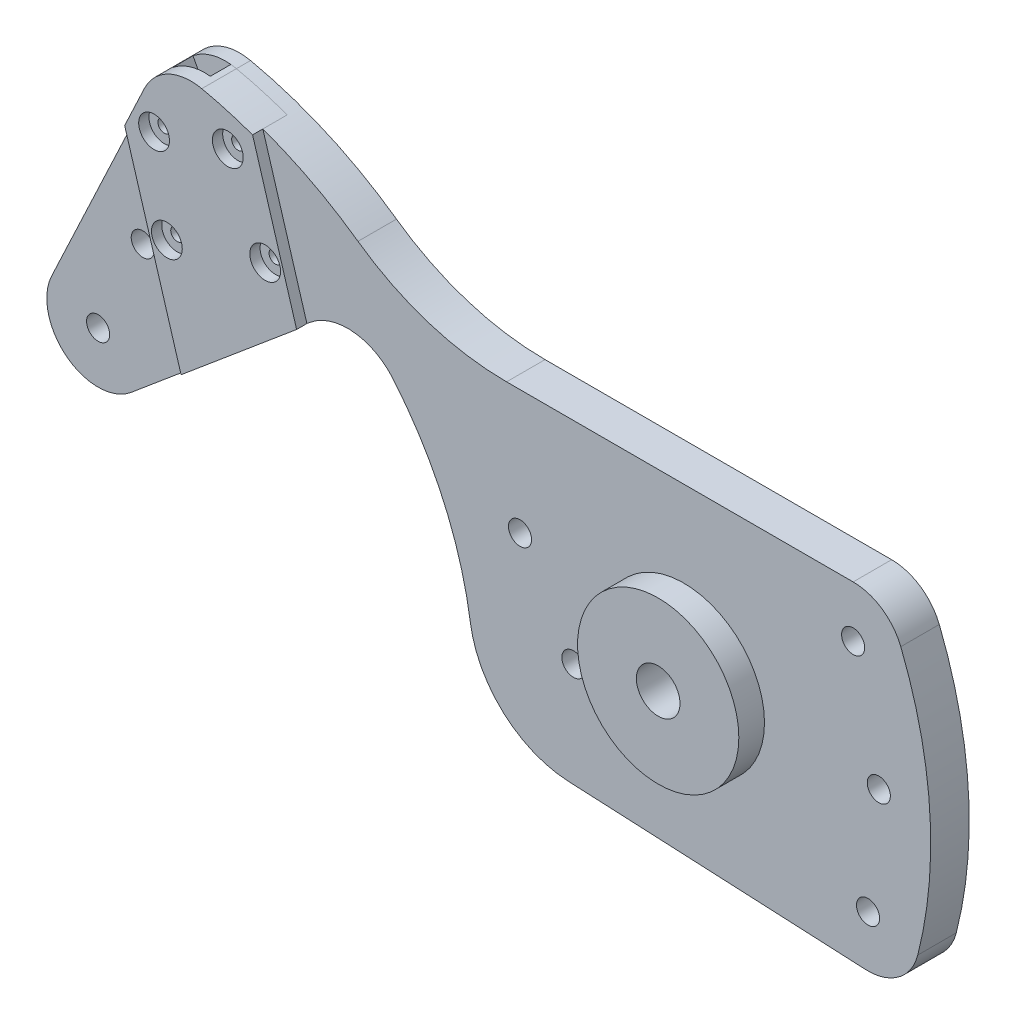
from build123d import *

# Parameters (mm, degrees)
SKETCH1_R              = 2.25
SKETCH1_R_2            = 4.25
BOSS_EXTRUDE1_DEPTH    = 4.75
CUT_EXTRUDE1_DEPTH     = 2
SKETCH4_R              = 1.25
CUT_EXTRUDE2_DEPTH     = 136.849086626
SKETCH5_R              = 3
CUT_EXTRUDE3_DEPTH     = 2
SPLIT3_SURFACE_1_BACK  = 193.818
SPLIT3_SURFACE_1_DEPTH = 387.636
SPLIT3_SURFACE_2_BACK  = 193.818
SPLIT3_SURFACE_2_DEPTH = 387.636
SKETCH6_R              = 15.710018396
CUT_EXTRUDE4_DEPTH     = 2
SKETCH7_R              = 15.710018396
SKETCH7_R_2            = 4.25
BOSS_EXTRUDE2_DEPTH    = 3


with BuildPart() as part:
    # Sketch1 → Boss-Extrude1 (new, symmetric)
    with BuildSketch(Plane.XY):
        with BuildLine():
            Line((-22.500230832, -28.983987123), (35.398437983, -31.788291003))
            ThreePointArc((35.398437983, -31.788291003), (41.825152283, -29.842482755), (45.572267137, -24.270413418))
            ThreePointArc((45.572267137, -24.270413418), (47.922199842, 1.185089324), (42.266415188, 26.115330067))
            ThreePointArc((42.266415188, 26.115330067), (38.587871094, 30.681102), (32.982217728, 32.4))
            Line((32.982217728, 32.4), (-34.53815208, 32.4))
            ThreePointArc((-34.53815208, 32.4), (-49.730929753, 34.764094355), (-63.487021029, 41.632819737))
            ThreePointArc((-63.487021029, 41.632819737), (-77.067258547, 49.344582351), (-91.918742124, 54.174444589))
            ThreePointArc((-91.918742124, 54.174444589), (-98.466295495, 53.366674665), (-103.085929893, 48.656905518))
            Line((-103.085929893, 48.656905518), (-123.167077545, 5.955614534))
            ThreePointArc((-123.167077545, 5.955614534), (-120.218280198, -6.2236308), (-107.689906175, -5.960444431))
            Line((-107.689906175, -5.960444431), (-72.864818345, 23.261273923))
            ThreePointArc((-72.864818345, 23.261273923), (-64.470178387, 25.908093735), (-56.662687309, 21.843771132))
            ThreePointArc((-56.662687309, 21.843771132), (-46.809939593, 6.135423294), (-41.608278072, -11.662653759))
            ThreePointArc((-41.608278072, -11.662653759), (-35.156858245, -23.745961099), (-22.500230832, -28.983987123))
        make_face()
        with Locations((35.882217728, -21.8)):
            Circle(SKETCH1_R, mode=Mode.SUBTRACT)
        with Locations((-21.517782272, -8.7)):
            Circle(SKETCH1_R, mode=Mode.SUBTRACT)
        Circle(SKETCH1_R_2, mode=Mode.SUBTRACT)
        with Locations((-31.917782272, 8.2)):
            Circle(SKETCH1_R, mode=Mode.SUBTRACT)
        with Locations((37.982217728, -0.1)):
            Circle(SKETCH1_R, mode=Mode.SUBTRACT)
        with Locations((32.982217728, 22.4)):
            Circle(SKETCH1_R, mode=Mode.SUBTRACT)
        with Locations((-105.417782272, 20.2)):
            Circle(SKETCH1_R, mode=Mode.SUBTRACT)
        with Locations((-114.117782272, 1.7)):
            Circle(SKETCH1_R, mode=Mode.SUBTRACT)
    extrude(amount=BOSS_EXTRUDE1_DEPTH, both=True)

    # Sketch2 → Cut-Extrude1 (cut, symmetric)
    with BuildSketch(Plane.XY):
        with BuildLine():
            Line((-78.227129447, 18.761760655), (-92.084556702, 44.987885053))
            Line((-92.084556702, 44.987885053), (-93.002217677, 54.347646176))
            ThreePointArc((-93.002217677, 54.347646176), (-96.914482214, 53.978242129), (-100.382341665, 52.129939126))
            Line((-100.382341665, 52.129939126), (-95.988712538, 43.814696916))
            Line((-95.988712538, 43.814696916), (-92.369017313, 6.895307763))
            Line((-92.369017313, 6.895307763), (-78.227129447, 18.761760655))
        make_face()
    extrude(amount=CUT_EXTRUDE1_DEPTH, both=True, mode=Mode.SUBTRACT)

    # Sketch4 → Cut-Extrude2 (cut, through all)
    with BuildSketch(Plane.XY.offset(4.75)):
        with Locations((-98.721244854, 25.242626445)):
            Circle(SKETCH4_R)
        with Locations((-101.219347979, 42.242905289)):
            Circle(SKETCH4_R)
        with Locations((-86.853921262, 46.55967668)):
            Circle(SKETCH4_R)
        with Locations((-79.567342565, 30.998321633)):
            Circle(SKETCH4_R)
    extrude(amount=-CUT_EXTRUDE2_DEPTH, mode=Mode.SUBTRACT)

    # Sketch5 → Cut-Extrude3 (cut)
    with BuildSketch(Plane.XY.offset(4.75)):
        with Locations((-101.219347979, 42.242905289)):
            Circle(SKETCH5_R)
        with Locations((-86.853921262, 46.55967668)):
            Circle(SKETCH5_R)
        with Locations((-79.567342565, 30.998321633)):
            Circle(SKETCH5_R)
        with Locations((-98.721244854, 25.242626445)):
            Circle(SKETCH5_R)
    extrude(amount=-CUT_EXTRUDE3_DEPTH, mode=Mode.SUBTRACT)


with BuildPart() as body_2:
    # Split3: the piece behind the surface
    add(part.part)
    # Split3 surface: a surface, the sketch's curves swept straight by 387.636 mm
    with BuildLine(Plane(origin=(-20.02556284, 66.641415389, 0), x_dir=(0.9576951144500195, 0.2877847594271872, 0), z_dir=(-0.2877847594271872, 0.9576951144500195, 0)).offset(-SPLIT3_SURFACE_1_BACK), mode=Mode.PRIVATE) as split3_surface_1_path:
        Line((-63.780410711, -4.75), (-63.780410711, 2))
        Line((-63.780410711, 2), (-90.780410711, 2))
        Line((-90.780410711, 2), (-90.780410711, -4.75))
    split3_surface_1 = Shell.extrude(split3_surface_1_path.wire(), (-0.287784759 * SPLIT3_SURFACE_1_DEPTH, 0.957695114 * SPLIT3_SURFACE_1_DEPTH, 0 * SPLIT3_SURFACE_1_DEPTH))
    split(bisect_by=split3_surface_1, keep=Keep.BOTTOM)

    # Sketch6 → Cut-Extrude4 (cut)
    # profile 1 of 2: a face of its own
    with BuildSketch(Plane.XY.offset(4.75)):
        with BuildLine():
            Line((-95.957666069, 3.884073915), (-106.945535827, 40.449697498))
            Line((-106.945535827, 40.449697498), (-123.167077545, 5.955614534))
            ThreePointArc((-123.167077545, 5.955614534), (-120.218280198, -6.2236308), (-107.689906175, -5.960444431))
            Line((-107.689906175, -5.960444431), (-95.957666069, 3.884073915))
        make_face()
    # profile 2 of 2: a face of its own
    with BuildSketch(Plane.XY.offset(4.75)):
        with BuildLine():
            Line((-82.022097036, 51.329163249), (-73.442190431, 22.776801219))
            Line((-73.442190431, 22.776801219), (-72.864818345, 23.261273923))
            ThreePointArc((-72.864818345, 23.261273923), (-64.470178387, 25.908093735), (-56.662687309, 21.843771132))
            ThreePointArc((-56.662687309, 21.843771132), (-46.809939593, 6.135423294), (-41.608278072, -11.662653759))
            ThreePointArc((-41.608278072, -11.662653759), (-35.156858245, -23.745961099), (-22.500230832, -28.983987123))
            Line((-22.500230832, -28.983987123), (35.398437983, -31.788291003))
            ThreePointArc((35.398437983, -31.788291003), (41.825152283, -29.842482755), (45.572267137, -24.270413418))
            ThreePointArc((45.572267137, -24.270413418), (47.922199842, 1.185089324), (42.266415188, 26.115330067))
            ThreePointArc((42.266415188, 26.115330067), (38.587871094, 30.681102), (32.982217728, 32.4))
            Line((32.982217728, 32.4), (-34.53815208, 32.4))
            ThreePointArc((-34.53815208, 32.4), (-49.730929753, 34.764094355), (-63.487021029, 41.632819737))
            ThreePointArc((-63.487021029, 41.632819737), (-72.425615765, 47.109784033), (-82.022097036, 51.329163249))
        make_face()
        Circle(SKETCH6_R, mode=Mode.SUBTRACT)
    extrude(amount=-CUT_EXTRUDE4_DEPTH, mode=Mode.SUBTRACT)

    # Sketch7 → Boss-Extrude2 (add)
    with BuildSketch(Plane.XY.offset(4.75)):
        Circle(SKETCH7_R)
        Circle(SKETCH7_R_2, mode=Mode.SUBTRACT)
    extrude(amount=BOSS_EXTRUDE2_DEPTH)


with BuildPart() as part_1:
    add(part.part)

    # Split3: split by a surface, the side it looks to stays
    # Split3 surface: a surface, the sketch's curves swept straight by 387.636 mm
    with BuildLine(Plane(origin=(-20.02556284, 66.641415389, 0), x_dir=(0.9576951144500195, 0.2877847594271872, 0), z_dir=(-0.2877847594271872, 0.9576951144500195, 0)).offset(-SPLIT3_SURFACE_2_BACK), mode=Mode.PRIVATE) as split3_surface_2_path:
        Line((-63.780410711, -4.75), (-63.780410711, 2))
        Line((-63.780410711, 2), (-90.780410711, 2))
        Line((-90.780410711, 2), (-90.780410711, -4.75))
    split3_surface_2 = Shell.extrude(split3_surface_2_path.wire(), (-0.287784759 * SPLIT3_SURFACE_2_DEPTH, 0.957695114 * SPLIT3_SURFACE_2_DEPTH, 0 * SPLIT3_SURFACE_2_DEPTH))
    split(bisect_by=split3_surface_2, keep=Keep.TOP)


solid = Compound([body_2.part, part_1.part])
